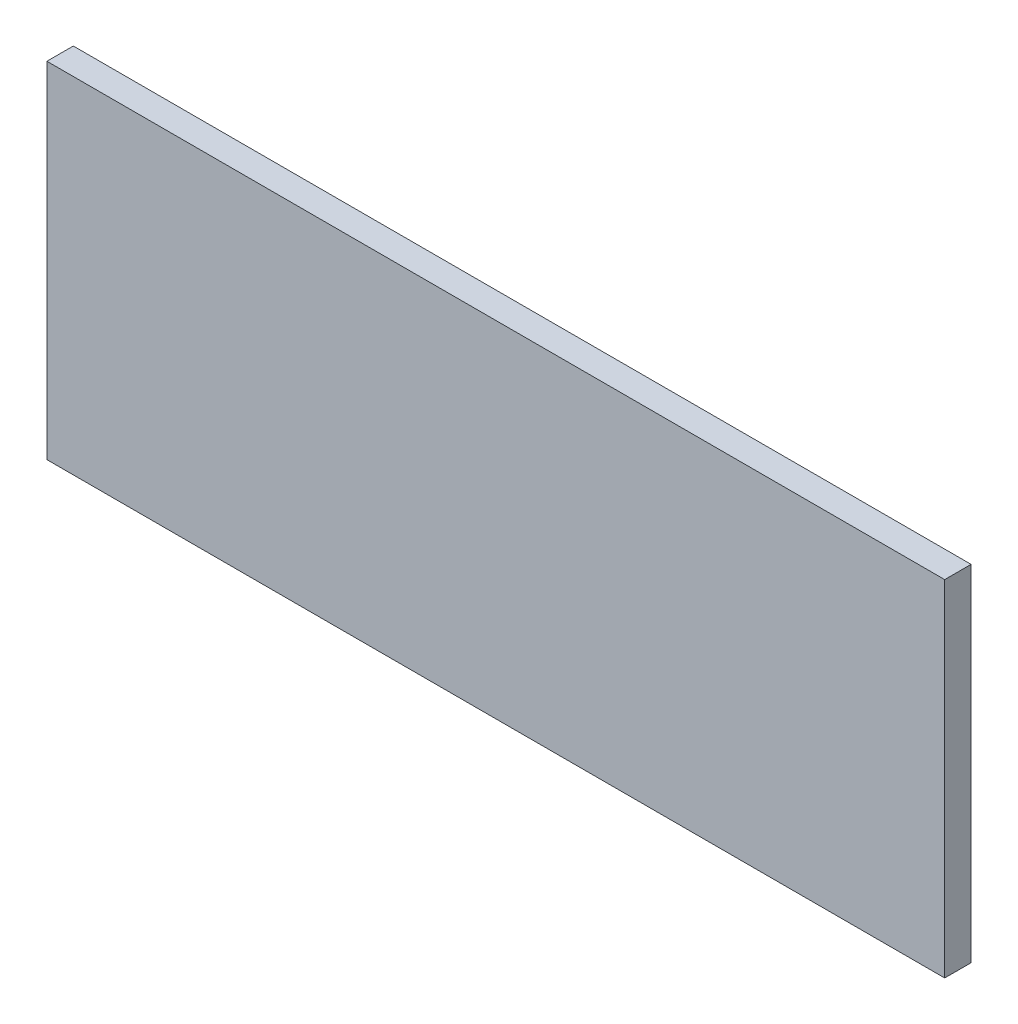
from build123d import *

# Parameters (mm, degrees)
TABAN_FLAN_1_DEPTH          = 30
KES_EKSTR_ZYON1_DEPTH       = 6331.979387109
KES_EKSTR_ZYON1_DEPTH_BACK  = 6331.979387109
IZIM2_W                     = 3010
IZIM2_H                     = 410
KES_EKSTR_ZYON2_DEPTH       = 6331.979387109
KES_EKSTR_ZYON2_DEPTH_BACK  = 6331.979387109
IZIM3_W                     = 170
IZIM3_H                     = 410
IZIM4_W                     = 25
IZIM4_H                     = 1460
SEKME1_DEPTH                = 30
KES_EKSTR_ZYON3_DEPTH       = 6213.326456329
KES_EKSTR_ZYON3_DEPTH_BACK  = 6213.326456329
IZIM5_W                     = 75
IZIM5_H                     = 150
KES_EKSTR_ZYON4_DEPTH       = 6176.151819996
KES_EKSTR_ZYON4_DEPTH_BACK  = 6176.151819996
IZIM6_W                     = 75
IZIM6_H                     = 90
IZIM6_W_2                   = 5
IZIM6_H_2                   = 645
KES_EKSTR_ZYON5_DEPTH       = 6171.293753137
KES_EKSTR_ZYON5_DEPTH_BACK  = 6171.293753137
IZIM9_W                     = 2920
IZIM9_H                     = 5
IZIM9_W_2                   = 3100
KES_EKSTR_ZYON6_DEPTH       = 6170.112577997
KES_EKSTR_ZYON6_DEPTH_BACK  = 6170.112577997
KES_EKSTR_ZYON7_DEPTH       = 3949.015324185
KES_EKSTR_ZYON7_DEPTH_BACK  = 3949.015324185
KES_EKSTR_ZYON8_DEPTH       = 2269.374969003
KES_EKSTR_ZYON8_DEPTH_BACK  = 2269.374969003
IZIM13_W                    = 523
IZIM13_H                    = 467
KES_EKSTR_ZYON9_DEPTH       = 2269.374969003
KES_EKSTR_ZYON9_DEPTH_BACK  = 2269.374969003
IZIM14_W                    = 740
IZIM14_H                    = 168
KES_EKSTR_ZYON10_DEPTH      = 1763.937888866
KES_EKSTR_ZYON10_DEPTH_BACK = 1763.937888866
IZIM15_W                    = 1020
IZIM15_H                    = 243


# Sheet-metal steps are written as plain solids
with BuildPart() as part:
    # Çizim1 → Taban-Flanş1 (new body)
    with BuildSketch(Plane.XY):
        Polygon((0, 0), (5240, 0), (5240, -90), (6000, -90), (6000, -2020), (0, -2020), align=None)
    extrude(amount=-TABAN_FLAN_1_DEPTH)

    # Çizim2 → Kes-Ekstrüzyon1 (cut, two sides: drawn at the far end of the back side and taken through both)
    with BuildSketch(Plane.XY.offset(-KES_EKSTR_ZYON1_DEPTH_BACK)):
        with Locations((4495, -1815)):
            Rectangle(IZIM2_W, IZIM2_H)
    extrude(amount=KES_EKSTR_ZYON1_DEPTH + KES_EKSTR_ZYON1_DEPTH_BACK, mode=Mode.SUBTRACT)

    # Çizim3 → Kes-Ekstrüzyon2 (cut, two sides: drawn at the far end of the back side and taken through both)
    with BuildSketch(Plane.XY.offset(-KES_EKSTR_ZYON2_DEPTH_BACK)):
        Polygon((0, -1460), (0, -2020), (2820, -2020), (2820, -1610), (2820, -1460), align=None)
        with Locations((2905, -1815)):
            Rectangle(IZIM3_W, IZIM3_H)
    extrude(amount=KES_EKSTR_ZYON2_DEPTH + KES_EKSTR_ZYON2_DEPTH_BACK, mode=Mode.SUBTRACT)

    # Çizim4 → Sekme1 (add)
    with BuildSketch(Plane.XY):
        with Locations((-12.5, -730)):
            Rectangle(IZIM4_W, IZIM4_H)
    extrude(amount=-SEKME1_DEPTH)

    # Çizim5 → Kes-Ekstrüzyon3 (cut, two sides: drawn at the far end of the back side and taken through both)
    with BuildSketch(Plane.XY.offset(-KES_EKSTR_ZYON3_DEPTH_BACK)):
        Polygon((2895, -1610), (6000, -1610), (6000, -1205), (2895, -1205), (2895, -1460), align=None)
        with Locations((2857.5, -1535)):
            Rectangle(IZIM5_W, IZIM5_H)
    extrude(amount=KES_EKSTR_ZYON3_DEPTH + KES_EKSTR_ZYON3_DEPTH_BACK, mode=Mode.SUBTRACT)

    # Çizim6 → Kes-Ekstrüzyon4 (cut, two sides: drawn at the far end of the back side and taken through both)
    with BuildSketch(Plane.XY.offset(-KES_EKSTR_ZYON4_DEPTH_BACK)):
        Polygon((6000, -560), (6000, -90), (5240, -90), (5165, -90), (5165, -560), (5995, -560), align=None)
        with Locations((5202.5, -45)):
            Rectangle(IZIM6_W, IZIM6_H)
        with Locations((5997.5, -882.5)):
            Rectangle(IZIM6_W_2, IZIM6_H_2)
    extrude(amount=KES_EKSTR_ZYON4_DEPTH + KES_EKSTR_ZYON4_DEPTH_BACK, mode=Mode.SUBTRACT)

    # Çizim9 → Kes-Ekstrüzyon5 (cut, two sides: drawn at the far end of the back side and taken through both)
    with BuildSketch(Plane.XY.offset(-KES_EKSTR_ZYON5_DEPTH_BACK)):
        with Locations((1435, -1457.5)):
            Rectangle(IZIM9_W, IZIM9_H)
        with Locations((4445, -1202.5)):
            Rectangle(IZIM9_W_2, IZIM9_H)
    extrude(amount=KES_EKSTR_ZYON5_DEPTH + KES_EKSTR_ZYON5_DEPTH_BACK, mode=Mode.SUBTRACT)

    # Çizim10 → Kes-Ekstrüzyon6 (cut, two sides: drawn at the far end of the back side and taken through both)
    with BuildSketch(Plane.XY.offset(-KES_EKSTR_ZYON6_DEPTH_BACK)):
        Polygon((3670, 0), (3670, -461), (2865, -461), (2865, -1455), (6281.695109379, -1455), (6281.695109379, 0), align=None)
    extrude(amount=KES_EKSTR_ZYON6_DEPTH + KES_EKSTR_ZYON6_DEPTH_BACK, mode=Mode.SUBTRACT)

    # Çizim11 → Kes-Ekstrüzyon7 (cut, two sides: drawn at the far end of the back side and taken through both)
    with BuildSketch(Plane.XY.offset(-KES_EKSTR_ZYON7_DEPTH_BACK)):
        Polygon((1740, 0), (1740, -988), (1523, -988), (1523, -1455), (2865, -1455), (2865, -461), (3670, -461), (3670, 0), align=None)
    extrude(amount=KES_EKSTR_ZYON7_DEPTH + KES_EKSTR_ZYON7_DEPTH_BACK, mode=Mode.SUBTRACT)

    # Çizim13 → Kes-Ekstrüzyon8 (cut, two sides: drawn at the far end of the back side and taken through both)
    with BuildSketch(Plane.XY.offset(-KES_EKSTR_ZYON8_DEPTH_BACK)):
        with Locations((1261.5, -1221.5)):
            Rectangle(IZIM13_W, IZIM13_H)
    extrude(amount=KES_EKSTR_ZYON8_DEPTH + KES_EKSTR_ZYON8_DEPTH_BACK, mode=Mode.SUBTRACT)

    # Çizim14 → Kes-Ekstrüzyon9 (cut, two sides: drawn at the far end of the back side and taken through both)
    with BuildSketch(Plane.XY.offset(-KES_EKSTR_ZYON9_DEPTH_BACK)):
        Polygon((1740, 0), (-25, 0), (-25, -820), (995, -820), (1000, -820), (1740, -820), align=None)
        with Locations((1370, -904)):
            Rectangle(IZIM14_W, IZIM14_H)
        Polygon((1000, -820), (995, -820), (995, -1455), (1000, -1455), (1000, -988), align=None)
    extrude(amount=KES_EKSTR_ZYON9_DEPTH + KES_EKSTR_ZYON9_DEPTH_BACK, mode=Mode.SUBTRACT)

    # Çizim15 → Kes-Ekstrüzyon10 (cut, two sides: drawn at the far end of the back side and taken through both)
    with BuildSketch(Plane.XY.offset(-KES_EKSTR_ZYON10_DEPTH_BACK)):
        with Locations((485, -941.5)):
            Rectangle(IZIM15_W, IZIM15_H)
    extrude(amount=KES_EKSTR_ZYON10_DEPTH + KES_EKSTR_ZYON10_DEPTH_BACK, mode=Mode.SUBTRACT)


solid = part.part
